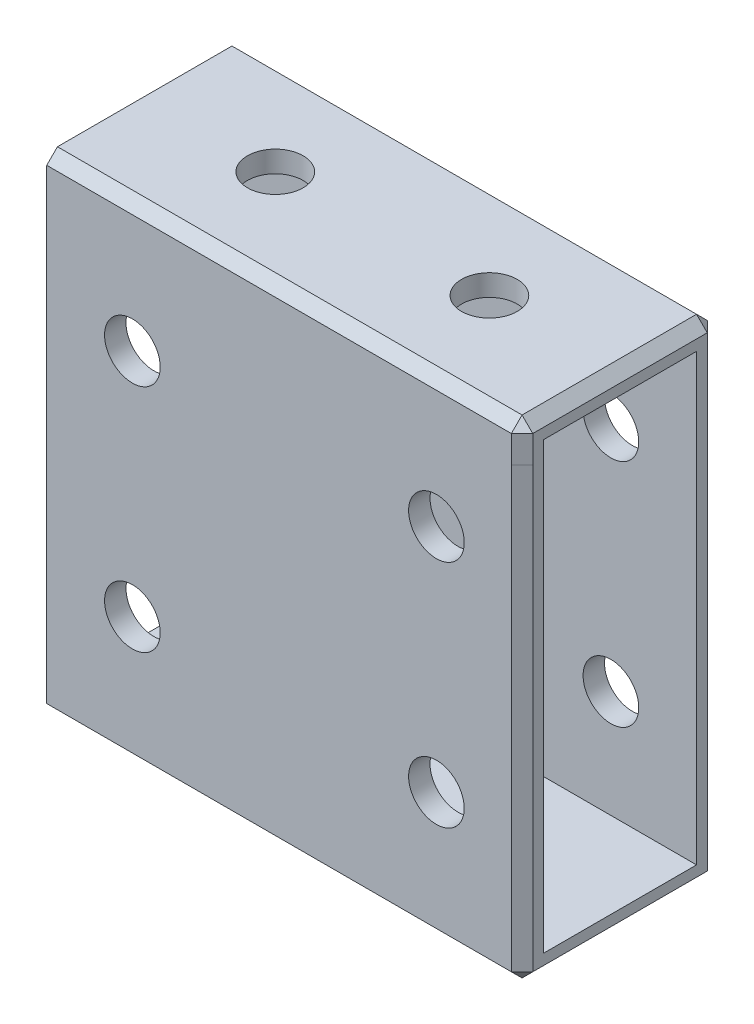
from build123d import *

# Parameters (mm, degrees)
SKETCH1_W               = 44.4
SKETCH1_H               = 40
SKETCH1_R               = 2.6
BOSS_EXTRUDE1_DEPTH     = 2
SKETCH2_W               = 44.4
SKETCH2_H               = 18.3
BOSS_EXTRUDE2_DEPTH     = 2
LPATTERN1_COUNT         = 2
LPATTERN1_PITCH         = 16.3
SKETCH3_R               = 2.6
CUT_EXTRUDE1_DEPTH      = 64.253853638
CHAMFER1_SIZE           = 1
MIRROR1_COPY_1_SKETCH_W = 44.4
MIRROR1_COPY_1_SKETCH_H = 40
MIRROR1_COPY_1_SKETCH_R = 2.6
MIRROR1_COPY_1_DEPTH    = 2
CHAMFER3_SIZE           = 1


with BuildPart() as part:
    # Sketch1 → Boss-Extrude1 (new body)
    with BuildSketch(Plane.XY):
        with Locations((22.2, 20)):
            Rectangle(SKETCH1_W, SKETCH1_H)
        with Locations((8, 8.476902454)):
            Circle(SKETCH1_R, mode=Mode.SUBTRACT)
        with Locations((8, 29.976902454)):
            Circle(SKETCH1_R, mode=Mode.SUBTRACT)
        with Locations((36.4, 29.976902454)):
            Circle(SKETCH1_R, mode=Mode.SUBTRACT)
        with Locations((36.4, 8.476902454)):
            Circle(SKETCH1_R, mode=Mode.SUBTRACT)
    boss_extrude1 = extrude(amount=BOSS_EXTRUDE1_DEPTH)

    # Sketch2 → Boss-Extrude2 (add)
    with BuildSketch(Plane(origin=(0, 40, 0), x_dir=(1, 0, 0), z_dir=(0, 1, 0))):
        with Locations((22.2, 7.15)):
            Rectangle(SKETCH2_W, SKETCH2_H)
    boss_extrude2 = extrude(amount=BOSS_EXTRUDE2_DEPTH)

    # LPattern1: Boss-Extrude1 ×2
    with Locations(*[(0, 0, -i * LPATTERN1_PITCH) for i in range(1, LPATTERN1_COUNT)]):
        add(boss_extrude1)

    # Sketch3 → Cut-Extrude1 (cut, through all)
    with BuildSketch(Plane(origin=(0, 42, 0), x_dir=(1, 0, 0), z_dir=(0, 1, 0))):
        with Locations(Location((12.2, 7.15, 0), (0, 0, 270))):
            Circle(SKETCH3_R)
        with Locations(Location((32.2, 7.15, 0), (0, 0, 270))):
            Circle(SKETCH3_R)
    extrude(amount=-CUT_EXTRUDE1_DEPTH, mode=Mode.SUBTRACT)

    # Chamfer1
    chamfer1_edges = [part.edges().sort_by_distance(p)[0] for p in [
        (44.4, 21, 2),
        (44.4, 21, -16.3),
        (22.2, 42, 2),
        (44.4, 42, -7.15),
        (22.2, 42, -16.3),
        (22.2, 0, -16.3),
        (0, 0, -15.3),
        (44.4, 0, -15.3),
        (44.4, 0, 1),
        (0, 0, 1),
        (22.2, 0, 2),
    ]]
    chamfer(chamfer1_edges, length=CHAMFER1_SIZE)

    # Mirror1: Boss-Extrude1, Boss-Extrude2 across plane
    add(boss_extrude1.mirror(Plane.ZX.offset(19.226902454)))
    add(boss_extrude2.mirror(Plane.ZX.offset(19.226902454)))

    # Mirror1 copy 1 sketch → Mirror1 copy 1 (add)
    with BuildSketch(Plane(origin=(0, 38.453804908, -16.3), x_dir=(1, 0, 0), z_dir=(0, 0, 1))):
        with Locations((22.2, -20)):
            Rectangle(MIRROR1_COPY_1_SKETCH_W, MIRROR1_COPY_1_SKETCH_H)
        with Locations((8, -8.476902454)):
            Circle(MIRROR1_COPY_1_SKETCH_R, mode=Mode.SUBTRACT)
        with Locations((8, -29.976902454)):
            Circle(MIRROR1_COPY_1_SKETCH_R, mode=Mode.SUBTRACT)
        with Locations((36.4, -29.976902454)):
            Circle(MIRROR1_COPY_1_SKETCH_R, mode=Mode.SUBTRACT)
        with Locations((36.4, -8.476902454)):
            Circle(MIRROR1_COPY_1_SKETCH_R, mode=Mode.SUBTRACT)
    extrude(amount=MIRROR1_COPY_1_DEPTH)

    # Chamfer3
    chamfer3_edges = [part.edges().sort_by_distance(p)[0] for p in [
        (44.4, 17.453804908, 2),
        (44.4, 17.453804908, -16.3),
        (22.2, -3.546195092, -16.3),
        (44.4, -3.546195092, -7.15),
        (22.2, -3.546195092, 2),
    ]]
    chamfer(chamfer3_edges, length=CHAMFER3_SIZE - 0.0001)  # a hair under: the kernel refuses the full size


solid = part.part
